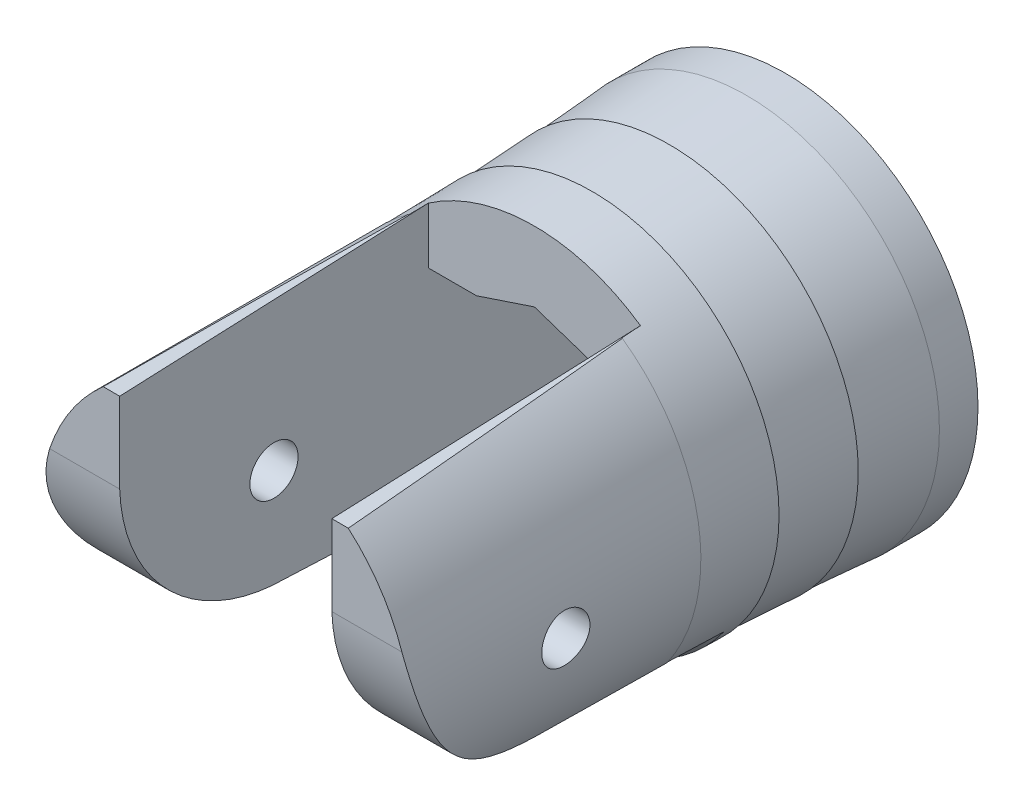
from build123d import *

# Parameters (mm, degrees)
SKETCH2_R               = 10
BOSS_EXTRUDE1_DEPTH     = 2
SKETCH3_R               = 10
BOSS_EXTRUDE2_DEPTH     = 4
BOSS_EXTRUDE2_TAPER     = 4
SKETCH4_R               = 9.790219564
BOSS_EXTRUDE3_DEPTH     = 4
BOSS_EXTRUDE3_TAPER     = 3
SKETCH5_R               = 9.685404006
BOSS_EXTRUDE4_DEPTH     = 4
BOSS_EXTRUDE4_TAPER     = 1
SKETCH6_R               = 9.633038811
BOSS_EXTRUDE5_DEPTH     = 15
CUT_EXTRUDE1_DEPTH      = 14
CUT_EXTRUDE1_DEPTH_BACK = 14
SKETCH7_W               = 11
SKETCH7_H               = 17.89942169
CUT_EXTRUDE4_DEPTH      = 14
CUT_EXTRUDE5_DEPTH      = 10
CUT_EXTRUDE5_DEPTH_BACK = 10
CHAMFER1_SIZE           = 2
CUT_EXTRUDE6_DEPTH      = 10
CUT_EXTRUDE6_DEPTH_BACK = 10
SKETCH11_R              = 1.25


with BuildPart() as part:
    # Sketch2 → Boss-Extrude1 (new body)
    with BuildSketch(Plane.XY):
        Circle(SKETCH2_R)
    extrude(amount=BOSS_EXTRUDE1_DEPTH)

    # Sketch3 → Boss-Extrude2 (add)
    with BuildSketch(Plane.XY.offset(2)):
        Circle(SKETCH3_R)
    extrude(amount=BOSS_EXTRUDE2_DEPTH, taper=BOSS_EXTRUDE2_TAPER)

    # Sketch4 → Boss-Extrude3 (add)
    with BuildSketch(Plane.XY.offset(6)):
        Circle(SKETCH4_R)
    extrude(amount=BOSS_EXTRUDE3_DEPTH, taper=BOSS_EXTRUDE3_TAPER)

    # Sketch5 → Boss-Extrude4 (add)
    with BuildSketch(Plane.XY.offset(10)):
        Circle(SKETCH5_R)
    extrude(amount=BOSS_EXTRUDE4_DEPTH, taper=BOSS_EXTRUDE4_TAPER)

    # Sketch6 → Boss-Extrude5 (add)
    with BuildSketch(Plane.XY.offset(14)):
        Circle(SKETCH6_R)
    extrude(amount=BOSS_EXTRUDE5_DEPTH)

    # Sketch7 → Cut-Extrude1 (cut, two sides: drawn at the far end of the back side and taken through both)
    with BuildSketch(Plane(origin=(0, 0, 0), x_dir=(1, 0, 0), z_dir=(0, 1, 0)).offset(-CUT_EXTRUDE1_DEPTH_BACK)):
        with Locations((0, -21.949710845)):
            Rectangle(SKETCH7_W, SKETCH7_H)
    extrude(amount=CUT_EXTRUDE1_DEPTH + CUT_EXTRUDE1_DEPTH_BACK, mode=Mode.SUBTRACT)

    # Sketch10 → Cut-Extrude4 (cut)
    with BuildSketch(Plane(origin=(0, 0, 0), x_dir=(-1, 0, 0), z_dir=(0, 0, -1))):
        Polygon((-5.5, 5), (-5.5, -4), (5.5, -4), (5.5, 5), (3, 5), (0, 6), (-3, 5), align=None)
    extrude(amount=-CUT_EXTRUDE4_DEPTH, mode=Mode.SUBTRACT)

    # Sketch8 → Cut-Extrude5 (cut, two sides: drawn at the far end of the back side and taken through both)
    with BuildSketch(Plane(origin=(0, 0, 0), x_dir=(0, 0, -1), z_dir=(1, 0, 0)).offset(-CUT_EXTRUDE5_DEPTH_BACK)):
        with BuildLine():
            Line((-13, 9.633038811), (-13, 7.9085673))
            Line((-13, 7.9085673), (-29, 7.240766023))
            Line((-29, 7.240766023), (-29, 3.070766023))
            ThreePointArc((-29, 3.070766023), (-26.359814718, -2.832037351), (-20.36, -5.243652859))
            Line((-20.36, -5.243652859), (-13, -5.5714327))
            Line((-13, -5.5714327), (-13, -9.633038811))
            Line((-13, -9.633038811), (-33.781866843, -9.633038811))
            Line((-33.781866843, -9.633038811), (-33.781866843, 9.633038811))
            Line((-33.781866843, 9.633038811), (-13, 9.633038811))
        make_face()
    extrude(amount=CUT_EXTRUDE5_DEPTH + CUT_EXTRUDE5_DEPTH_BACK, mode=Mode.SUBTRACT)

    # Chamfer1
    # the kernel refuses this chamfer: 2 mm, written as the material it takes off along each edge
    with BuildSketch(Plane(origin=(0, 0, 13), x_dir=(0.9966107214684086, -0.08226220185612716, 1.2908177907304536e-15), z_dir=(0.08226220185612716, 0.9966107214684086, 1.0371882149808466e-15))) as chamfer1_piece_1_section:
        Polygon((9.633038811 + CHAMFER1_SIZE * 0.0174524064373, CHAMFER1_SIZE * 0.999847695156), (9.633038811 - CHAMFER1_SIZE, 0), (9.633038811, 0), align=None)
    chamfer1_piece_1 = revolve(axis=Axis((0, 0, 13), (0, 0, -1)), revolution_arc=170.562781842, mode=Mode.PRIVATE)
    chamfer1_piece_1 = split(chamfer1_piece_1, bisect_by=Plane(origin=(-5.5, -5.504615156, 12.950413225), z_dir=(1, 0, 0)), keep=Keep.TOP, mode=Mode.PRIVATE)
    chamfer1_piece_1 = split(chamfer1_piece_1, bisect_by=Plane(origin=(5.5, -5.504615156, 12.950413225), z_dir=(-1, 0, 0)), keep=Keep.TOP, mode=Mode.PRIVATE)
    add(chamfer1_piece_1, mode=Mode.SUBTRACT)
    with BuildSketch(Plane(origin=(0, 0, 13), x_dir=(0.9966107214684086, -0.08226220185612716, 1.2908177907304536e-15), z_dir=(0.08226220185612716, 0.9966107214684086, 1.0371882149808466e-15))) as chamfer1_piece_2_section:
        Polygon((9.633038811 + CHAMFER1_SIZE * 0.0174524064373, CHAMFER1_SIZE * 0.999847695156), (9.633038811 - CHAMFER1_SIZE, 0), (9.633038811, 0), align=None)
    chamfer1_piece_2 = revolve(axis=Axis((0, 0, 13), (0, 0, -1)), revolution_arc=170.562781842, mode=Mode.PRIVATE)
    chamfer1_piece_2 = split(chamfer1_piece_2, bisect_by=Plane(origin=(6.416338432, -5.607046409, 12.200326364), z_dir=(0, -0.9990097760809877, 0.04449120468828483)), keep=Keep.TOP, mode=Mode.PRIVATE)
    add(chamfer1_piece_2, mode=Mode.SUBTRACT)

    # Sketch11 → Cut-Extrude6 (cut, two sides: drawn at the far end of the back side and taken through both)
    with BuildSketch(Plane(origin=(0, 0, 0), x_dir=(0, 0, -1), z_dir=(1, 0, 0)).offset(-CUT_EXTRUDE6_DEPTH_BACK)):
        with Locations(Location((-21, -0.0914327, 0), (0, 0, 180))):
            Circle(SKETCH11_R)
    extrude(amount=CUT_EXTRUDE6_DEPTH + CUT_EXTRUDE6_DEPTH_BACK, mode=Mode.SUBTRACT)


solid = part.part
